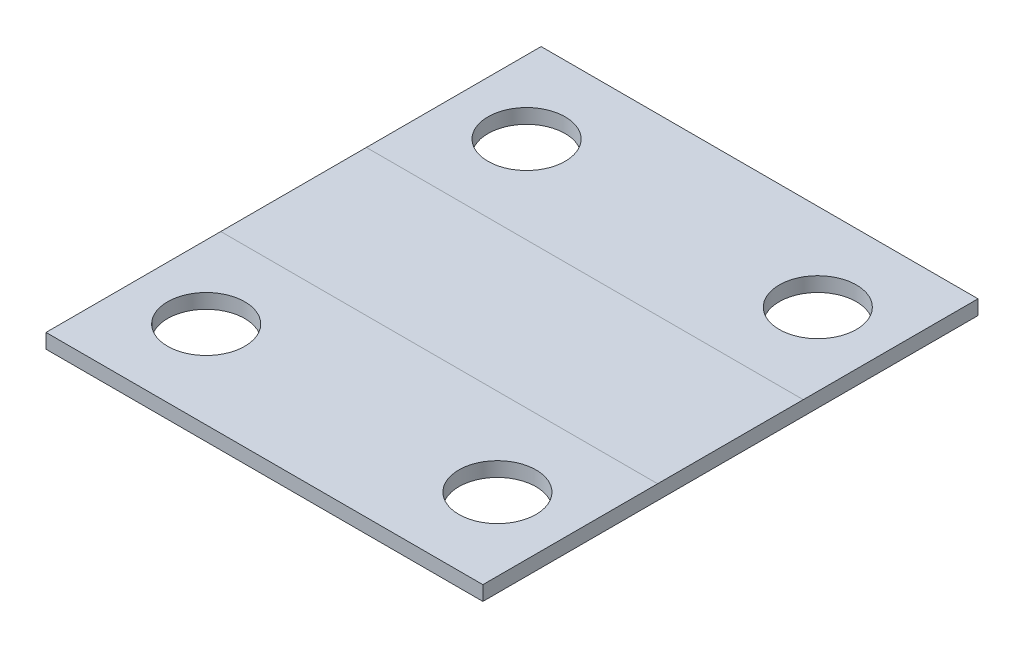
from build123d import *

# Parameters (mm, degrees)
BASE_FLANGE1_START     = -0.5
BASE_FLANGE1_OUTLINE_W = 30
BASE_FLANGE1_OUTLINE_H = 34
BASE_FLANGE1_DEPTH     = 1
M5_CLEARANCE_HOLE2_D   = 5.3


# Read off the part's stored shape, not the designer's step: Base-Flange1
with BuildPart() as part:
    # Base-Flange1 outline → Base-Flange1 (new body)
    with BuildSketch(Plane(origin=(0, 0, 0), x_dir=(1, 0, 0), z_dir=(0, 1, 0)).offset(BASE_FLANGE1_START)):
        Rectangle(BASE_FLANGE1_OUTLINE_W, BASE_FLANGE1_OUTLINE_H)
    extrude(amount=BASE_FLANGE1_DEPTH)

    # M5 Clearance Hole2 (through all)
    with Locations(Plane(origin=(0, 0.5, 0), x_dir=(1, 0, 0), z_dir=(0, 1, 0))):
        with Locations((-10, -11), (10, -11), (-10, 11), (10, 11)):
            Hole(M5_CLEARANCE_HOLE2_D / 2)


solid = part.part
